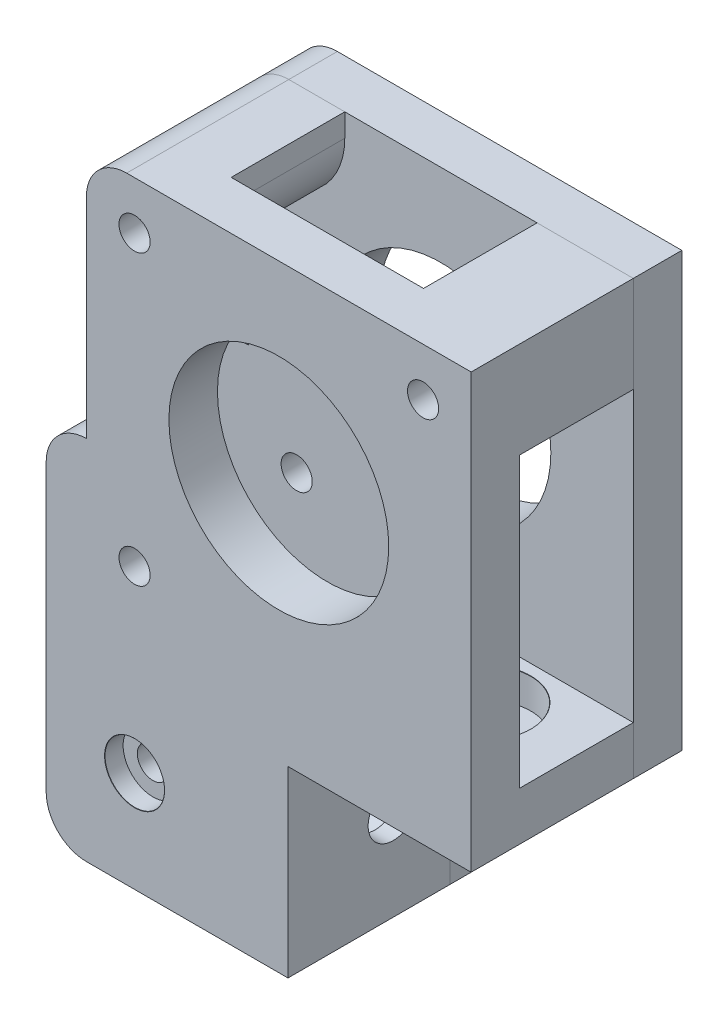
from build123d import *

# Parameters (mm, degrees)
SKETCH16_W                                 = 42
SKETCH16_H                                 = 42
BOSS_EXTRUDE4_DEPTH                        = 5.3
SKETCH19_W                                 = 20
SKETCH19_H                                 = 5.3
BOSS_EXTRUDE7_DEPTH                        = 23
SKETCH20_W                                 = 5.3
SKETCH20_H                                 = 25.3
BOSS_EXTRUDE8_DEPTH                        = 23
SKETCH21_W                                 = 16.7
SKETCH21_H                                 = 5.3
BOSS_EXTRUDE9_DEPTH                        = 25.3
BOSS_EXTRUDE10_DEPTH                       = 5.3
SKETCH27_W                                 = 10.5
SKETCH27_H                                 = 10.5
BOSS_EXTRUDE11_DEPTH                       = 12.4
SKETCH29_W                                 = 4.4
SKETCH29_H                                 = 5.3
BOSS_EXTRUDE12_DEPTH                       = 40
CUT_EXTRUDE2_REACH                         = 59.601
SKETCH38_R                                 = 2
CUT_EXTRUDE3_DEPTH                         = 58.600781245
CUT_EXTRUDE3_DEPTH_BACK                    = 58.600781245
SKETCH39_R                                 = 12
FILLET1_R                                  = 10
FILLET2_R                                  = 8
FILLET3_R                                  = 8
FILLET4_R                                  = 4.39
FILLET5_R                                  = 4.39
FILLET6_R                                  = 4.39
FILLET7_R                                  = 4.39
FILLET8_R                                  = 4.39
SKETCH41_R                                 = 4
BOSS_EXTRUDE13_DEPTH                       = 2
FILLET9_R                                  = 4.39
CBORE_FOR_M3_CHEESE_HEAD_SCREW3_AT_2_COUNT = 2
CBORE_FOR_M3_CHEESE_HEAD_SCREW3_AT_2_PITCH = 31.5
CBORE_FOR_M3_CHEESE_HEAD_SCREW3_AT_3_COUNT = 2
CBORE_FOR_M3_CHEESE_HEAD_SCREW3_AT_3_PITCH = 44.547727215


with BuildPart() as part:
    # Sketch16 → Boss-Extrude4 (new body)
    with BuildSketch(Plane.XY):
        Rectangle(SKETCH16_W, SKETCH16_H)
    extrude(amount=-BOSS_EXTRUDE4_DEPTH)

    # Sketch19 → Boss-Extrude7 (add)
    with BuildSketch(Plane.XY):
        with Locations((11, -23.65)):
            Rectangle(SKETCH19_W, SKETCH19_H)
    extrude(amount=-BOSS_EXTRUDE7_DEPTH)

    # Sketch20 → Boss-Extrude8 (add)
    with BuildSketch(Plane.XY):
        with Locations((-1.65, -33.65)):
            Rectangle(SKETCH20_W, SKETCH20_H)
    extrude(amount=-BOSS_EXTRUDE8_DEPTH)

    # Sketch21 → Boss-Extrude9 (add)
    with BuildSketch(Plane.XZ.offset(21)):
        with Locations((-12.65, -2.65)):
            Rectangle(SKETCH21_W, SKETCH21_H)
    extrude(amount=BOSS_EXTRUDE9_DEPTH)

    # Sketch22 → Boss-Extrude10 (add)
    with BuildSketch(Plane(origin=(0, 0, -23), x_dir=(-1, 0, 0), z_dir=(0, 0, -1))):
        Polygon((-21, -21), (-21, 21), (21, 21), (21, -46.3), (4.3, -46.3), (4.3, -21), align=None)
    extrude(amount=-BOSS_EXTRUDE10_DEPTH)

    # Sketch25 → CBORE for M5 Cheese Head Screw1 (revolve, cut)
    with BuildSketch(Plane(origin=(11, -21, -11.5), x_dir=(0, 0, 1), z_dir=(1, 0, 0))):
        Polygon((0, 0), (0, 5.3), (2.75, 5.3), (2.75, 3.3), (5, 3.3), (5, 0.025), (5.025, 0), align=None)
    revolve(axis=Axis((11, -14.65, -11.5), (0, -1, 0)), mode=Mode.SUBTRACT)

    # Sketch25 at point 2 (carried to point 2, square into its face) → CBORE for M5 Cheese Head Screw1 at 2 (revolve, cut)
    with BuildSketch(Plane(origin=(-4.3, -36.3, -11.5), x_dir=(0, 0, 1), z_dir=(0, 1, 0))):
        Polygon((0, 0), (0, 5.3), (2.75, 5.3), (2.75, 3.3), (5, 3.3), (5, 0.025), (5.025, 0), align=None)
    revolve(axis=Axis((-10.65, -36.3, -11.5), (1, 0, 0)), mode=Mode.SUBTRACT)

    # Sketch27 → Boss-Extrude11 (add)
    with BuildSketch(Plane(origin=(0, 0, -5.3), x_dir=(-1, 0, 0), z_dir=(0, 0, -1))):
        with Locations((15.75, 15.75)):
            Rectangle(SKETCH27_W, SKETCH27_H)
        with Locations((-15.75, 15.75)):
            Rectangle(SKETCH27_W, SKETCH27_H)
    extrude(amount=BOSS_EXTRUDE11_DEPTH)

    # Sketch29 → Boss-Extrude12 (add)
    with BuildSketch(Plane.XZ.offset(46.3)):
        with Locations((-23.2, -2.65)):
            Rectangle(SKETCH29_W, SKETCH29_H)
        with Locations((-23.2, -20.35)):
            Rectangle(SKETCH29_W, SKETCH29_H)
    extrude(amount=-BOSS_EXTRUDE12_DEPTH)

    # Sketch38 → Cut-Extrude2 (cut, up to next)
    with BuildSketch(Plane(origin=(0, 0, -23), x_dir=(-1, 0, 0), z_dir=(0, 0, -1)), mode=Mode.PRIVATE) as cut_extrude2_sk1:
        with Locations((15.75, -35.3)):
            Circle(SKETCH38_R)
    cut_extrude2_tool1 = extrude(cut_extrude2_sk1.sketch, amount=-CUT_EXTRUDE2_REACH, mode=Mode.PRIVATE) & part.part
    add(cut_extrude2_tool1.solids().sort_by_distance((-15.75, -35.3, -23))[0], mode=Mode.SUBTRACT)

    # Sketch39 → Cut-Extrude3 (cut, two sides: drawn at the far end of the back side and taken through both)
    with BuildSketch(Plane(origin=(0, 0, -23), x_dir=(-1, 0, 0), z_dir=(0, 0, -1)).offset(-CUT_EXTRUDE3_DEPTH_BACK)):
        Circle(SKETCH39_R)
    extrude(amount=CUT_EXTRUDE3_DEPTH + CUT_EXTRUDE3_DEPTH_BACK, mode=Mode.SUBTRACT)

    # Fillet1
    fillet1_edges = [part.edges().sort_by_distance(p)[0] for p in [
        (-4.3, -21, -11.5),
    ]]
    fillet(fillet1_edges, radius=FILLET1_R)

    # Fillet2
    fillet2_edges = [part.edges().sort_by_distance(p)[0] for p in [
        (-10.5, 10.5, -11.5),
    ]]
    fillet(fillet2_edges, radius=FILLET2_R)

    # Fillet3
    fillet3_edges = [part.edges().sort_by_distance(p)[0] for p in [
        (10.5, 10.5, -11.5),
    ]]
    fillet(fillet3_edges, radius=FILLET3_R)

    # Fillet4
    fillet4_edges = [part.edges().sort_by_distance(p)[0] for p in [
        (-25.4, -6.3, -2.65),
    ]]
    fillet(fillet4_edges, radius=FILLET4_R)

    # Fillet5
    fillet5_edges = [part.edges().sort_by_distance(p)[0] for p in [
        (-25.4, -46.3, -2.65),
    ]]
    fillet(fillet5_edges, radius=FILLET5_R)

    # Fillet6
    fillet6_edges = [part.edges().sort_by_distance(p)[0] for p in [
        (-25.4, -6.3, -20.35),
    ]]
    fillet(fillet6_edges, radius=FILLET6_R)

    # Fillet7
    fillet7_edges = [part.edges().sort_by_distance(p)[0] for p in [
        (-25.4, -46.3, -20.35),
    ]]
    fillet(fillet7_edges, radius=FILLET7_R)

    # Fillet8
    fillet8_edges = [part.edges().sort_by_distance(p)[0] for p in [
        (-21, 21, -11.5),
    ]]
    fillet(fillet8_edges, radius=FILLET8_R)


with BuildPart() as body_2:
    # Split1: the piece on the far side of the plane
    add(part.part)
    split(bisect_by=Plane.XY.offset(-17.7), keep=Keep.BOTTOM)


with BuildPart() as part_1:
    add(part.part)

    # Split1
    split(bisect_by=Plane.XY.offset(-17.7), keep=Keep.TOP)

    # Sketch41 → Boss-Extrude13 (add)
    with BuildSketch(Plane(origin=(0, 0, -5.3), x_dir=(-1, 0, 0), z_dir=(0, 0, -1))):
        with Locations(Location((15.75, -35.3, 0), (0, 0, 180))):
            Circle(SKETCH41_R)
        with Locations(Location((15.75, -15.75, 0), (0, 0, 180))):
            Circle(SKETCH41_R)
    extrude(amount=BOSS_EXTRUDE13_DEPTH)

    # Fillet9
    # the kernel refuses this fillet: 4.39 mm, written as the material it adds along each edge
    with BuildSketch(Plane(origin=(-15.75, -35.3, -5.3), x_dir=(1, 0, 0), z_dir=(0, 1, 0))) as fillet9_piece_1:
        with BuildLine():
            CenterArc((7.682390528, 4.39), FILLET9_R, 212.984978244, 57.015021756)
            Line((4, 2), (3.926352189, 1.9522))
            ThreePointArc((3.926352189, 1.9522), (3.9122, 1), (3.9122, 0))
            Line((3.9122, 0), (4, -0.0878))
            Line((4, -0.0878), (7.682390528, -0.0878))
            Line((7.682390528, -0.0878), (7.682390528, 0))
        make_face()
    revolve(axis=Axis((-15.75, -35.3, -5.3), (0, 0, -1)))
    with BuildSketch(Plane(origin=(-15.75, -15.75, -5.3), x_dir=(1, 0, 0), z_dir=(0, 1, 0))) as fillet9_piece_2:
        with BuildLine():
            CenterArc((7.682390528, 4.39), FILLET9_R, 212.984978244, 57.015021756)
            Line((4, 2), (3.926352189, 1.9522))
            ThreePointArc((3.926352189, 1.9522), (3.9122, 1), (3.9122, 0))
            Line((3.9122, 0), (4, -0.0878))
            Line((4, -0.0878), (7.682390528, -0.0878))
            Line((7.682390528, -0.0878), (7.682390528, 0))
        make_face()
    revolve(axis=Axis((-15.75, -15.75, -5.3), (0, 0, -1)))


with BuildPart() as cbore_for_m3_cheese_head_screw3_tool:
    # Sketch37 → CBORE for M3 Cheese Head Screw3 (revolve)
    with BuildSketch(Plane(origin=(-15.75, -15.75, -23), x_dir=(0, 1, 0), z_dir=(1, 0, 0))):
        Polygon((0, 0), (0, 23), (1.7, 23), (1.7, 2), (3.25, 2), (3.25, 0.025), (3.275, 0), align=None)
    cbore_for_m3_cheese_head_screw3 = revolve(axis=Axis((-15.75, -15.75, -29.35), (0, 0, 1)))


with BuildPart() as part_2:
    add(part_1.part)

    # CBORE for M3 Cheese Head Screw3: cut by cbore_for_m3_cheese_head_screw3_tool
    add(cbore_for_m3_cheese_head_screw3_tool.part, mode=Mode.SUBTRACT)


with BuildPart() as body_2_1:
    add(body_2.part)

    # CBORE for M3 Cheese Head Screw3: cut by cbore_for_m3_cheese_head_screw3_tool
    add(cbore_for_m3_cheese_head_screw3_tool.part, mode=Mode.SUBTRACT)


with BuildPart() as cbore_for_m3_cheese_head_screw3_at_2_tool:
    # CBORE for M3 Cheese Head Screw3 at 2: CBORE for M3 Cheese Head Screw3 ×2
    with Locations(*[(0, i * CBORE_FOR_M3_CHEESE_HEAD_SCREW3_AT_2_PITCH, 0) for i in range(1, CBORE_FOR_M3_CHEESE_HEAD_SCREW3_AT_2_COUNT)]):
        add(cbore_for_m3_cheese_head_screw3)


with BuildPart() as part_3:
    add(part_2.part)

    # CBORE for M3 Cheese Head Screw3 at 2: cut by cbore_for_m3_cheese_head_screw3_at_2_tool
    add(cbore_for_m3_cheese_head_screw3_at_2_tool.part, mode=Mode.SUBTRACT)


with BuildPart() as body_2_2:
    add(body_2_1.part)

    # CBORE for M3 Cheese Head Screw3 at 2: cut by cbore_for_m3_cheese_head_screw3_at_2_tool
    add(cbore_for_m3_cheese_head_screw3_at_2_tool.part, mode=Mode.SUBTRACT)


with BuildPart() as cbore_for_m3_cheese_head_screw3_at_3_tool:
    # CBORE for M3 Cheese Head Screw3 at 3: CBORE for M3 Cheese Head Screw3 ×2
    with Locations(*[Vector(0.7071067811865475, 0.7071067811865476, 0) * (i * CBORE_FOR_M3_CHEESE_HEAD_SCREW3_AT_3_PITCH) for i in range(1, CBORE_FOR_M3_CHEESE_HEAD_SCREW3_AT_3_COUNT)]):
        add(cbore_for_m3_cheese_head_screw3)


with BuildPart() as part_4:
    add(part_3.part)

    # CBORE for M3 Cheese Head Screw3 at 3: cut by cbore_for_m3_cheese_head_screw3_at_3_tool
    add(cbore_for_m3_cheese_head_screw3_at_3_tool.part, mode=Mode.SUBTRACT)

    # Sketch34 → CBORE for M3 Cheese Head Screw1 (revolve, cut)
    with BuildSketch(Plane(origin=(-15.75, -35.3, 0), x_dir=(0, -1, 0), z_dir=(1, 0, 0))):
        Polygon((0, 0), (0, 23), (1.7, 23), (1.7, 2), (3.25, 2), (3.25, 0.025), (3.275, 0), align=None)
    revolve(axis=Axis((-15.75, -35.3, 6.35), (0, 0, -1)), mode=Mode.SUBTRACT)


with BuildPart() as body_2_3:
    add(body_2_2.part)

    # CBORE for M3 Cheese Head Screw3 at 3: cut by cbore_for_m3_cheese_head_screw3_at_3_tool
    add(cbore_for_m3_cheese_head_screw3_at_3_tool.part, mode=Mode.SUBTRACT)


solid = Compound([part_4.part, body_2_3.part])
